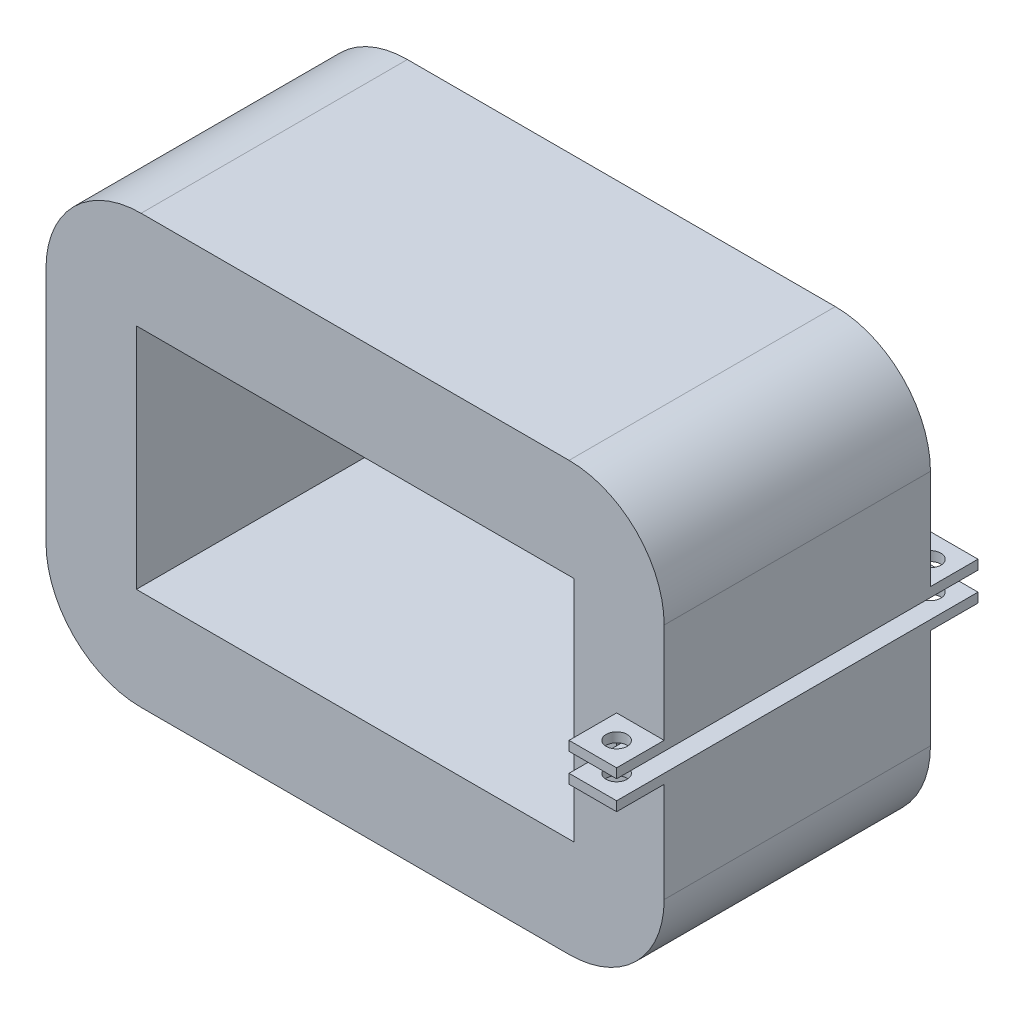
from build123d import *

# Parameters (mm, degrees)
SKETCH_1_W               = 65
SKETCH_1_H               = 45
EXTRUDE_1_DEPTH          = 28
SKETCH_2_W               = 46
SKETCH_2_H               = 24
CUT_EXTRUDE_1_DEPTH      = 39
FILLET_1_R               = 10
FILLET_2_R               = 10
FILLET_3_R               = 10
FILLET_4_R               = 10
CUT_EXTRUDE_2_DEPTH      = 1
CUT_EXTRUDE_2_DEPTH_BACK = 1
SKETCH_9_W               = 5
SKETCH_9_H               = 34.070621565
SKETCH_10_W              = 5
SKETCH_10_H              = 1
EXTRUDE_5_DEPTH          = 5
SKETCH_12_R              = 1.1
CUT_EXTRUDE_3_DEPTH      = 5
PATTERN_LINEAR_1_COUNT   = 2
PATTERN_LINEAR_1_PITCH   = 33
PATTERN_LINEAR_2_COUNT   = 2
PATTERN_LINEAR_2_PITCH   = 33


with BuildPart() as part:
    # 草圖1 → 填料-伸長1 (new body)
    with BuildSketch(Plane.XY):
        with Locations((-27.434655272, 0)):
            Rectangle(SKETCH_1_W, SKETCH_1_H)
    extrude(amount=EXTRUDE_1_DEPTH)

    # 草圖2 → 除料-伸長1 (cut)
    with BuildSketch(Plane.XY):
        with Locations((-27.434655272, 0)):
            Rectangle(SKETCH_2_W, SKETCH_2_H)
    extrude(amount=CUT_EXTRUDE_1_DEPTH, mode=Mode.SUBTRACT)

    # 圓角1
    fillet_1_edges = [part.edges().sort_by_distance(p)[0] for p in [
        (-59.934655272, -22.5, 14),
    ]]
    fillet(fillet_1_edges, radius=FILLET_1_R)

    # 圓角2
    fillet_2_edges = [part.edges().sort_by_distance(p)[0] for p in [
        (-59.934655272, 22.5, 14),
    ]]
    fillet(fillet_2_edges, radius=FILLET_2_R)

    # 圓角3
    fillet_3_edges = [part.edges().sort_by_distance(p)[0] for p in [
        (5.065344728, 22.5, 14),
    ]]
    fillet(fillet_3_edges, radius=FILLET_3_R)

    # 圓角4
    fillet_4_edges = [part.edges().sort_by_distance(p)[0] for p in [
        (5.065344728, -22.5, 14),
    ]]
    fillet(fillet_4_edges, radius=FILLET_4_R)

    # 草圖9 → 除料-伸長2 (cut, two sides: drawn at the far end of the back side and taken through both)
    with BuildSketch(Plane(origin=(0, 0, 0), x_dir=(1, 0, 0), z_dir=(0, 1, 0)).offset(-CUT_EXTRUDE_2_DEPTH_BACK)):
        with Locations((2.565344728, -13.723230761)):
            Rectangle(SKETCH_9_W, SKETCH_9_H)
    extrude(amount=CUT_EXTRUDE_2_DEPTH + CUT_EXTRUDE_2_DEPTH_BACK, mode=Mode.SUBTRACT)

    # 草圖10 → 填料-伸長5 (add)
    with BuildSketch(Plane.XY):
        with Locations((2.565344728, -1.5)):
            Rectangle(SKETCH_10_W, SKETCH_10_H)
        with Locations((2.565344728, 1.5)):
            Rectangle(SKETCH_10_W, SKETCH_10_H)
    extrude_5 = extrude(amount=-EXTRUDE_5_DEPTH)

    # 草圖12 → 除料-伸長3 (cut)
    with BuildSketch(Plane(origin=(0, -2, 0), x_dir=(-1, 0, 0), z_dir=(0, -1, 0))):
        with Locations((-2.565344728, 2.5)):
            Circle(SKETCH_12_R)
    cut_extrude_3 = extrude(amount=-CUT_EXTRUDE_3_DEPTH, mode=Mode.SUBTRACT)

    # 直線複製排列1: 填料-伸長5 ×2
    with Locations(*[(0, 0, i * PATTERN_LINEAR_1_PITCH) for i in range(1, PATTERN_LINEAR_1_COUNT)]):
        add(extrude_5)

    # 直線複製排列2: 除料-伸長3 ×2
    with Locations(*[(0, 0, i * PATTERN_LINEAR_2_PITCH) for i in range(1, PATTERN_LINEAR_2_COUNT)]):
        add(cut_extrude_3, mode=Mode.SUBTRACT)


solid = part.part
